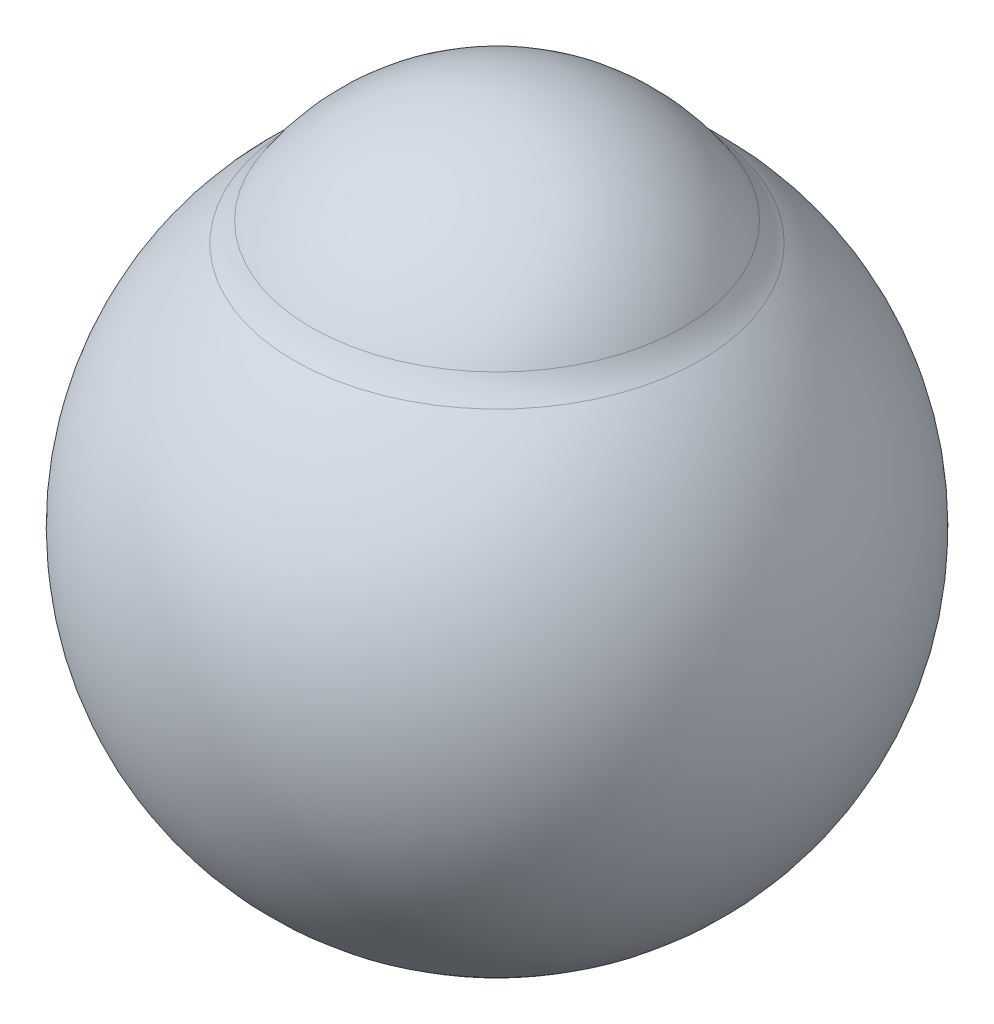
from build123d import *


with BuildPart() as part:
    # Sketch6 → lens (revolve)
    with BuildSketch(Plane.XY):
        with BuildLine():
            ThreePointArc((4.704997748, 2.904001144), (2.424869951, 3.781546563), (0, 4.08))
            Line((0, 4.08), (0, 0.38))
            ThreePointArc((0, 0.38), (2.643822882, 0.993888177), (4.746641894, 2.709933144))
            ThreePointArc((4.746641894, 2.709933144), (4.77088424, 2.816637307), (4.704997748, 2.904001144))
        make_face()
    revolve(axis=Axis((0, 60.244207804, 0), (0, -1, 0)))


with BuildPart() as body_2:
    # Sketch6<7> → iris (revolve)
    with BuildSketch(Plane.XY):
        with BuildLine():
            Line((5.886123402, 4.08), (5.548153632, 4.336060606))
            ThreePointArc((5.548153632, 4.336060606), (5.553680131, 4.233128157), (5.465345369, 4.18))
            Line((5.465345369, 4.18), (1.5, 4.18))
            Line((1.5, 4.18), (1.5, 4.08))
            Line((1.5, 4.08), (5.492861113, 4.08))
            Line((5.492861113, 4.08), (5.886123402, 4.08))
        make_face()
    revolve(axis=Axis((0, 60.244207804, 0), (0, -1, 0)))

    # Sketch6<12> → ciliary body (revolve)
    with BuildSketch(Plane.XY):
        with BuildLine():
            Line((6.45968041, 3.692562089), (5.886123402, 4.08))
            Line((5.886123402, 4.08), (5.492861113, 4.08))
            ThreePointArc((5.492861113, 4.08), (5.666844203, 3.978640177), (5.66447834, 3.777298844))
            add(Edge.make_bspline(
                [(5.66447834, 3.777298844), (5.52797511, 3.549197167), (5.417228742, 2.854359981), (6.983816782, 2.521940583), (8.08067984, 1.917370456), (8.532298411, 1.729952463)],
                knots=[0.065550843, 0.065550843, 0.065550843, 0.065550843, 0.226972151, 0.688222094, 1, 1, 1, 1], degree=3))
            ThreePointArc((8.532298411, 1.729952463), (7.559948173, 2.778801061), (6.45968041, 3.692562089))
        make_face()
    revolve(axis=Axis((0, 60.244207804, 0), (0, -1, 0)))

    # Sketch6<13> → sclera (revolve)
    with BuildSketch(Plane.XY):
        with BuildLine():
            add(Edge.make_bspline(
                [(5.548153632, 4.336060606), (5.40298249, 5.044933477), (6.051343216, 4.92625791), (6.520858839, 4.28)],
                knots=[0, 0, 0, 0, 1, 1, 1, 1], degree=3))
            Line((5.548153632, 4.336060606), (5.886123402, 4.08))
            Line((5.886123402, 4.08), (6.45968041, 3.692562089))
            ThreePointArc((6.45968041, 3.692562089), (7.559948173, 2.778801061), (8.532298411, 1.729952463))
            ThreePointArc((8.532298411, 1.729952463), (9.928284236, -9.929455102), (0, -16.2))
            Line((0, -16.2), (0, -16.52))
            ThreePointArc((0, -16.52), (10.633298815, -9.043997424), (7.196762351, 3.491866142))
            ThreePointArc((7.196762351, 3.491866142), (6.859713943, 3.817824959), (6.577571883, 4.192320136))
            ThreePointArc((6.577571883, 4.192320136), (6.54936209, 4.236254975), (6.520858839, 4.28))
        make_face()
    revolve(axis=Axis((0, 60.244207804, 0), (0, -1, 0)))

    # Sketch6<14> → cornea (revolve)
    with BuildSketch(Plane.XY):
        with BuildLine():
            ThreePointArc((0, 7.28), (3.140413503, 6.498429102), (5.548153632, 4.336060606))
            add(Edge.make_bspline(
                [(5.548153632, 4.336060606), (5.40298249, 5.044933477), (6.051343216, 4.92625791), (6.520858839, 4.28)],
                knots=[0, 0, 0, 0, 1, 1, 1, 1], degree=3))
            ThreePointArc((6.520858839, 4.28), (3.705131577, 6.863818179), (0, 7.8))
            Line((0, 7.8), (0, 7.28))
        make_face()
    revolve(axis=Axis((0, 60.244207804, 0), (0, -1, 0)))


solid = Compound([part.part, body_2.part])
